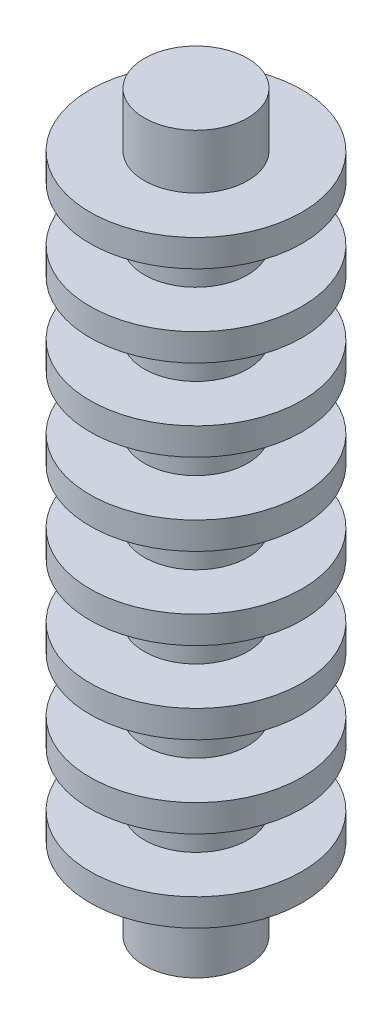
from build123d import *


with BuildPart() as part:
    # Sketch1 → Revolve1 (revolve)
    with BuildSketch(Plane.XY):
        Polygon((3.8, 24), (3.8, 23), (7.8, 23), (7.8, 21), (3.8, 21), (3.8, 18), (3.8, 17), (7.8, 17), (7.8, 15), (3.8, 15), (3.8, 12), (3.8, 11), (7.8, 11), (7.8, 9), (3.8, 9), (3.8, 6), (3.8, 5), (7.8, 5), (7.8, 3), (3.8, 3), (3.8, 0), (3.8, -1), (7.8, -1), (7.8, -3), (3.8, -3), (3.8, -6), (3.8, -7), (7.8, -7), (7.8, -9), (3.8, -9), (3.8, -12), (3.8, -13), (7.8, -13), (7.8, -15), (3.8, -15), (3.8, -18), (3.8, -19), (7.8, -19), (7.8, -21), (3.8, -21), (3.8, -24), (3.8, -27), (0, -27), (0, 27), (3.8, 27), align=None)
    revolve(axis=Axis((0, 27, 0), (0, -1, 0)))


solid = part.part
